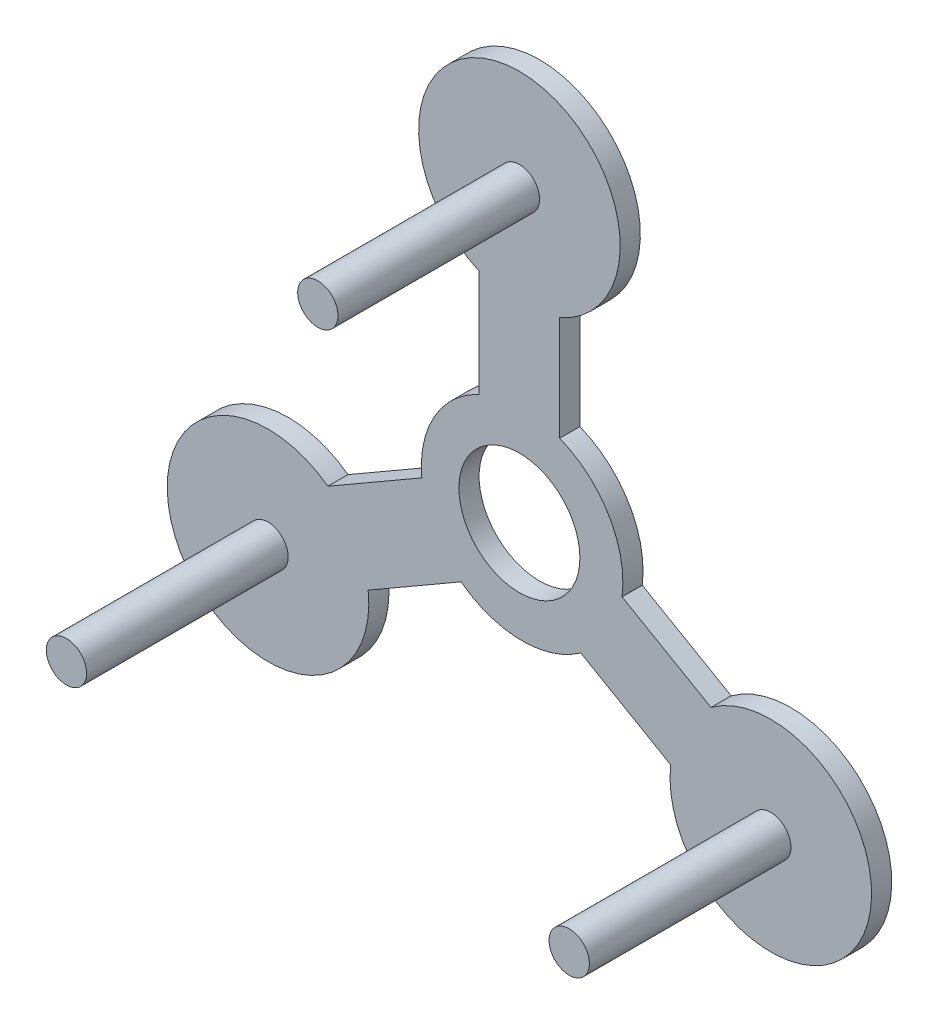
from build123d import *

# Parameters (mm, degrees)
BOSS_EXTRUDE2_DEPTH = 10
SKETCH3_R           = 50
BOSS_EXTRUDE3_DEPTH = 10
SKETCH4_R           = 10
BOSS_EXTRUDE4_DEPTH = 90
CUT_EXTRUDE1_START  = -30
SKETCH5_R           = 10
CUT_EXTRUDE1_DEPTH  = 30
SKETCH6_R           = 13
CUT_EXTRUDE2_DEPTH  = 10
SKETCH7_R           = 10
BOSS_EXTRUDE5_DEPTH = 30
SKETCH9_R           = 10
BOSS_EXTRUDE6_DEPTH = 10
SKETCH10_R          = 10
BOSS_EXTRUDE7_DEPTH = 10
SKETCH11_R          = 10
BOSS_EXTRUDE8_DEPTH = 10
SKETCH12_R          = 50
BOSS_EXTRUDE9_DEPTH = 10
SKETCH13_R          = 30
CUT_EXTRUDE3_DEPTH  = 10


with BuildPart() as part:
    # Sketch1 → Boss-Extrude2 (new body)
    with BuildSketch(Plane.XY):
        Polygon((20, 144), (-20, 144), (-20, 11.547005384), (-134.707658145, -54.679491924), (-114.707658145, -89.320508076), (0, -23.094010768), (114.707658145, -89.320508076), (134.707658145, -54.679491924), (20, 11.547005384), align=None)
    extrude(amount=BOSS_EXTRUDE2_DEPTH)

    # Sketch3 → Boss-Extrude3 (add)
    with BuildSketch(Plane.XY.offset(10)):
        with Locations((-124.707658145, -72)):
            Circle(SKETCH3_R)
        with Locations((0, 144)):
            Circle(SKETCH3_R)
        with Locations((124.707658145, -72)):
            Circle(SKETCH3_R)
    extrude(amount=-BOSS_EXTRUDE3_DEPTH)

    # Sketch4 → Boss-Extrude4 (add)
    with BuildSketch(Plane.XY.offset(10)):
        with Locations((0, 144)):
            Circle(SKETCH4_R)
        with Locations((124.707658145, -72)):
            Circle(SKETCH4_R)
        with Locations((-124.707658145, -72)):
            Circle(SKETCH4_R)
    extrude(amount=BOSS_EXTRUDE4_DEPTH)

    # Sketch5 → Cut-Extrude1 (cut)
    with BuildSketch(Plane.XY.offset(100).offset(CUT_EXTRUDE1_START)):
        with Locations((0, 144)):
            Circle(SKETCH5_R)
    extrude(amount=CUT_EXTRUDE1_DEPTH, mode=Mode.SUBTRACT)

    # Sketch6 → Cut-Extrude2 (cut)
    with BuildSketch(Plane.XY.offset(10)):
        Circle(SKETCH6_R)
    extrude(amount=-CUT_EXTRUDE2_DEPTH, mode=Mode.SUBTRACT)

    # Sketch7 → Boss-Extrude5 (add)
    with BuildSketch(Plane.XY.offset(70)):
        with Locations((0, 144)):
            Circle(SKETCH7_R)
    extrude(amount=BOSS_EXTRUDE5_DEPTH)

    # Sketch9 → Boss-Extrude6 (add)
    with BuildSketch(Plane.XY.offset(100)):
        with Locations((0, 144)):
            Circle(SKETCH9_R)
    extrude(amount=BOSS_EXTRUDE6_DEPTH)

    # Sketch10 → Boss-Extrude7 (add)
    with BuildSketch(Plane.XY.offset(100)):
        with Locations((-124.707658145, -72)):
            Circle(SKETCH10_R)
    extrude(amount=BOSS_EXTRUDE7_DEPTH)

    # Sketch11 → Boss-Extrude8 (add)
    with BuildSketch(Plane.XY.offset(100)):
        with Locations((124.707658145, -72)):
            Circle(SKETCH11_R)
    extrude(amount=BOSS_EXTRUDE8_DEPTH)

    # Sketch12 → Boss-Extrude9 (add)
    with BuildSketch(Plane.XY.offset(10)):
        with Locations((1.330805308, 0)):
            Circle(SKETCH12_R)
    extrude(amount=-BOSS_EXTRUDE9_DEPTH)

    # Sketch13 → Cut-Extrude3 (cut)
    with BuildSketch(Plane.XY.offset(10)):
        Circle(SKETCH13_R)
    extrude(amount=-CUT_EXTRUDE3_DEPTH, mode=Mode.SUBTRACT)


solid = part.part
